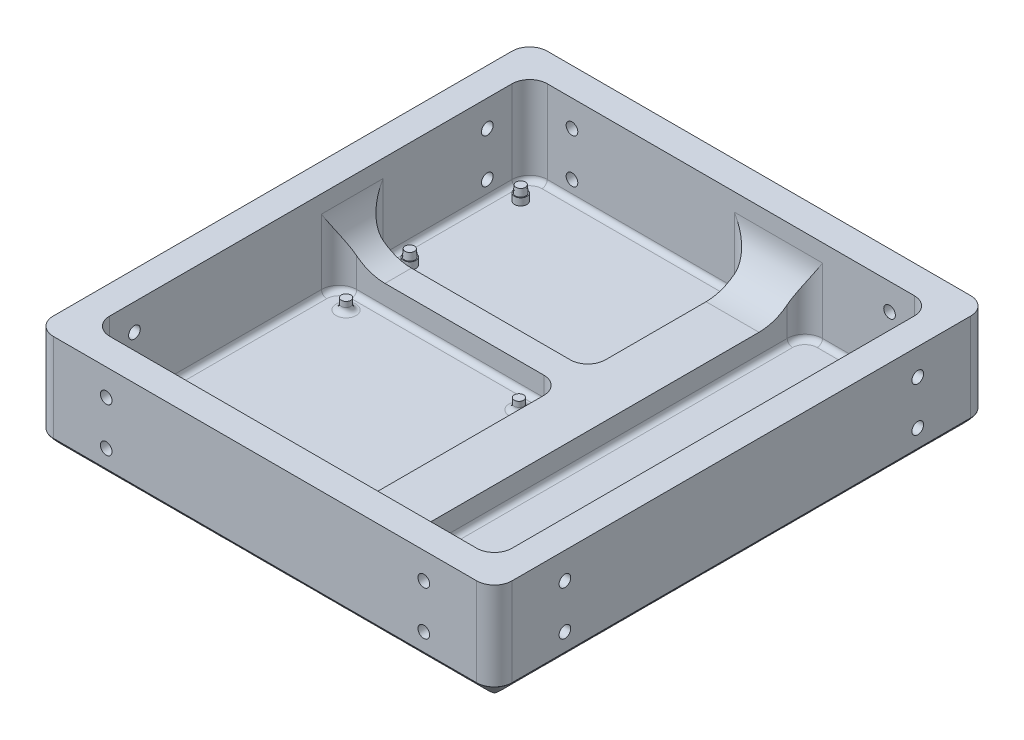
from build123d import *
from OCP.BRepFilletAPI import BRepFilletAPI_MakeChamfer

# Parameters (mm, degrees)
SKETCH1_W                      = 130
SKETCH1_H                      = 140
BOSS_EXTRUDE2_DEPTH            = 10
SKETCH3_R                      = 1.3
BOSS_EXTRUDE4_DEPTH            = 2
SKETCH4_R                      = 1.15
BOSS_EXTRUDE5_DEPTH            = 3
BOSS_EXTRUDE5_DRAFT            = -5
BOSS_EXTRUDE5_PROFILE_2_DEPTH  = 3
BOSS_EXTRUDE5_PROFILE_2_DRAFT  = -5
BOSS_EXTRUDE5_PROFILE_3_DEPTH  = 3
BOSS_EXTRUDE5_PROFILE_3_DRAFT  = -5
BOSS_EXTRUDE5_PROFILE_4_DEPTH  = 3
BOSS_EXTRUDE5_PROFILE_4_DRAFT  = -5
CHAMFER1_SIZE                  = 1.5
CHAMFER1_SIZE2                 = 1.38459352
SKETCH5_W                      = 110
SKETCH5_H                      = 120
BOSS_EXTRUDE6_DEPTH            = 20
SKETCH7_W                      = 114
SKETCH7_H                      = 124
SKETCH7_W_2                    = 110
SKETCH7_H_2                    = 120
CUT_EXTRUDE2_DEPTH             = 20
SKETCH9_W                      = 15
SKETCH9_H                      = 124
BOSS_EXTRUDE8_DEPTH            = 5
SKETCH10_W                     = 63
SKETCH10_H                     = 7.5
BOSS_EXTRUDE9_DEPTH            = 5
SKETCH12_W                     = 63
SKETCH12_H                     = 46.5
SKETCH12_W_2                   = 36
SKETCH12_H_2                   = 124
SKETCH12_H_3                   = 70
SKETCH12_R                     = 1.327872471
SKETCH12_R_2                   = 1.253859906
CUT_EXTRUDE6_DEPTH             = 5
SKETCH14_W                     = 59.963590068
SKETCH14_H                     = 68.475850711
CUT_EXTRUDE9_DEPTH             = 7
SKETCH16_W                     = 114
SKETCH16_H                     = 124
CUT_EXTRUDE10_DEPTH            = 3
FILLET12_R                     = 13
FILLET13_R                     = 5
FILLET14_R                     = 5
FILLET15_R                     = 1.5
SKETCH24_R                     = 1.65
CUT_EXTRUDE16_DEPTH            = 10
CUT_EXTRUDE17_START            = -10
SKETCH25_R                     = 1.65
CUT_EXTRUDE17_DEPTH            = 10
SKETCH26_R                     = 1.65
CUT_EXTRUDE18_DEPTH            = 10
CUT_EXTRUDE19_START            = -10
SKETCH27_R                     = 1.65
CUT_EXTRUDE19_DEPTH            = 10
FILLET17_SIZE                  = 5
SKETCH30_R                     = 1.75
BOSS_EXTRUDE10_DEPTH           = 2
SKETCH31_R                     = 1.5
BOSS_EXTRUDE11_DEPTH           = 2
BOSS_EXTRUDE11_DRAFT           = 5
BOSS_EXTRUDE11_PROFILE_2_DEPTH = 2
BOSS_EXTRUDE11_PROFILE_2_DRAFT = 5


with BuildPart() as part:
    # Sketch1 → Boss-Extrude2 (new body)
    with BuildSketch(Plane(origin=(0, 0, 0), x_dir=(1, 0, 0), z_dir=(0, 1, 0))):
        with Locations((-18.656773153, -29.741986999)):
            Rectangle(SKETCH1_W, SKETCH1_H)
    extrude(amount=BOSS_EXTRUDE2_DEPTH)

    # Sketch3 → Boss-Extrude4 (add)
    with BuildSketch(Plane(origin=(0, 10, 0), x_dir=(1, 0, 0), z_dir=(0, 1, 0))):
        with Locations(Location((-68.656773153, -26.741986999, 0), (0, 0, 270))):
            Circle(SKETCH3_R)
        with Locations(Location((-19.656773153, -26.741986999, 0), (0, 0, 270))):
            Circle(SKETCH3_R)
        with Locations(Location((-68.656773153, -84.741986999, 0), (0, 0, 270))):
            Circle(SKETCH3_R)
        with Locations(Location((-19.656773153, -84.741986999, 0), (0, 0, 270))):
            Circle(SKETCH3_R)
    extrude(amount=BOSS_EXTRUDE4_DEPTH)


with BuildPart() as boss_extrude5_tool:
    # Sketch4 → Boss-Extrude5 (with draft: the straight prism first)
    with BuildSketch(Plane(origin=(0, 12, 0), x_dir=(1, 0, 0), z_dir=(0, 1, 0))):
        with Locations((-68.656773153, -26.741986999)):
            Circle(SKETCH4_R)
    extrude(amount=BOSS_EXTRUDE5_DEPTH)
    # Boss-Extrude5: the draft: its side faces are tilted about the plane it starts from
    boss_extrude5_sides = [boss_extrude5_tool.faces().sort_by_distance(p)[0] for p in [
        (-69.806773153, 13.5, 26.741986999),
    ]]
    draft(boss_extrude5_sides, Plane(origin=(0, 12, 0), x_dir=(1, 0, 0), z_dir=(0, 1, 0)), BOSS_EXTRUDE5_DRAFT)


with BuildPart() as part_1:
    add(part.part)

    # Boss-Extrude5: add boss_extrude5_tool
    add(boss_extrude5_tool.part)


with BuildPart() as boss_extrude5_profile_2_tool:
    # Sketch4 → Boss-Extrude5 profile 2 (with draft: the straight prism first)
    with BuildSketch(Plane(origin=(0, 12, 0), x_dir=(1, 0, 0), z_dir=(0, 1, 0))):
        with Locations((-68.656773153, -84.741986999)):
            Circle(SKETCH4_R)
    extrude(amount=BOSS_EXTRUDE5_PROFILE_2_DEPTH)
    # Boss-Extrude5 profile 2: the draft: its side faces are tilted about the plane it starts from
    boss_extrude5_profile_2_sides = [boss_extrude5_profile_2_tool.faces().sort_by_distance(p)[0] for p in [
        (-69.806773153, 13.5, 84.741986999),
    ]]
    draft(boss_extrude5_profile_2_sides, Plane(origin=(0, 12, 0), x_dir=(1, 0, 0), z_dir=(0, 1, 0)), BOSS_EXTRUDE5_PROFILE_2_DRAFT)


with BuildPart() as part_2:
    add(part_1.part)

    # Boss-Extrude5 profile 2: add boss_extrude5_profile_2_tool
    add(boss_extrude5_profile_2_tool.part)


with BuildPart() as boss_extrude5_profile_3_tool:
    # Sketch4 → Boss-Extrude5 profile 3 (with draft: the straight prism first)
    with BuildSketch(Plane(origin=(0, 12, 0), x_dir=(1, 0, 0), z_dir=(0, 1, 0))):
        with Locations((-19.656773153, -84.741986999)):
            Circle(SKETCH4_R)
    extrude(amount=BOSS_EXTRUDE5_PROFILE_3_DEPTH)
    # Boss-Extrude5 profile 3: the draft: its side faces are tilted about the plane it starts from
    boss_extrude5_profile_3_sides = [boss_extrude5_profile_3_tool.faces().sort_by_distance(p)[0] for p in [
        (-20.806773153, 13.5, 84.741986999),
    ]]
    draft(boss_extrude5_profile_3_sides, Plane(origin=(0, 12, 0), x_dir=(1, 0, 0), z_dir=(0, 1, 0)), BOSS_EXTRUDE5_PROFILE_3_DRAFT)


with BuildPart() as part_3:
    add(part_2.part)

    # Boss-Extrude5 profile 3: add boss_extrude5_profile_3_tool
    add(boss_extrude5_profile_3_tool.part)


with BuildPart() as boss_extrude5_profile_4_tool:
    # Sketch4 → Boss-Extrude5 profile 4 (with draft: the straight prism first)
    with BuildSketch(Plane(origin=(0, 12, 0), x_dir=(1, 0, 0), z_dir=(0, 1, 0))):
        with Locations((-19.656773153, -26.741986999)):
            Circle(SKETCH4_R)
    extrude(amount=BOSS_EXTRUDE5_PROFILE_4_DEPTH)
    # Boss-Extrude5 profile 4: the draft: its side faces are tilted about the plane it starts from
    boss_extrude5_profile_4_sides = [boss_extrude5_profile_4_tool.faces().sort_by_distance(p)[0] for p in [
        (-20.806773153, 13.5, 26.741986999),
    ]]
    draft(boss_extrude5_profile_4_sides, Plane(origin=(0, 12, 0), x_dir=(1, 0, 0), z_dir=(0, 1, 0)), BOSS_EXTRUDE5_PROFILE_4_DRAFT)


with BuildPart() as part_4:
    add(part_3.part)

    # Boss-Extrude5 profile 4: add boss_extrude5_profile_4_tool
    add(boss_extrude5_profile_4_tool.part)

    # Chamfer1: one chamfer whose edges measure the first distance from different faces: ONE call of the kernel's chamfer builder (chamfer() names one face for all edges)
    chamfer1_edges_1 = [part_4.edges().sort_by_distance(p)[0] for p in [
        (-70.069239144, 15, 26.741986999),
    ]]
    chamfer1_side_1 = [part_4.faces().sort_by_distance(p)[0] for p in [
        (-69.938006148, 13.5, 26.741986999),
    ]]
    chamfer1_edges_2 = [part_4.edges().sort_by_distance(p)[0] for p in [
        (-70.069239144, 15, 84.741986999),
    ]]
    chamfer1_side_2 = [part_4.faces().sort_by_distance(p)[0] for p in [
        (-69.938006148, 13.5, 84.741986999),
    ]]
    chamfer1_edges_3 = [part_4.edges().sort_by_distance(p)[0] for p in [
        (-21.069239144, 15, 84.741986999),
    ]]
    chamfer1_side_3 = [part_4.faces().sort_by_distance(p)[0] for p in [
        (-20.938006148, 13.5, 84.741986999),
    ]]
    chamfer1_edges_4 = [part_4.edges().sort_by_distance(p)[0] for p in [
        (-21.069239144, 15, 26.741986999),
    ]]
    chamfer1_side_4 = [part_4.faces().sort_by_distance(p)[0] for p in [
        (-20.938006148, 13.5, 26.741986999),
    ]]
    chamfer1 = BRepFilletAPI_MakeChamfer(part_4.part.solid().wrapped)
    for e in chamfer1_edges_1:
        chamfer1.Add(CHAMFER1_SIZE, CHAMFER1_SIZE2, e.wrapped, chamfer1_side_1[0].wrapped)  # the first distance lies on this face
    for e in chamfer1_edges_2:
        chamfer1.Add(CHAMFER1_SIZE, CHAMFER1_SIZE2, e.wrapped, chamfer1_side_2[0].wrapped)  # the first distance lies on this face
    for e in chamfer1_edges_3:
        chamfer1.Add(CHAMFER1_SIZE, CHAMFER1_SIZE2, e.wrapped, chamfer1_side_3[0].wrapped)  # the first distance lies on this face
    for e in chamfer1_edges_4:
        chamfer1.Add(CHAMFER1_SIZE, CHAMFER1_SIZE2, e.wrapped, chamfer1_side_4[0].wrapped)  # the first distance lies on this face
    add(Compound.cast(chamfer1.Shape()), mode=Mode.REPLACE)

    # Sketch5 → Boss-Extrude6 (add)
    with BuildSketch(Plane(origin=(0, 10, 0), x_dir=(1, 0, 0), z_dir=(0, 1, 0))):
        Polygon((-83.656773153, -89.741986999), (-83.656773153, -99.741986999), (-73.656773153, -99.741986999), (36.343226847, -99.741986999), (46.343226847, -99.741986999), (46.343226847, -89.741986999), (46.343226847, 30.258013001), (46.343226847, 40.258013001), (36.343226847, 40.258013001), (-73.656773153, 40.258013001), (-83.656773153, 40.258013001), (-83.656773153, 30.258013001), align=None)
        with Locations((-18.656773153, -29.741986999)):
            Rectangle(SKETCH5_W, SKETCH5_H, mode=Mode.SUBTRACT)
    extrude(amount=BOSS_EXTRUDE6_DEPTH)

    # Sketch7 → Cut-Extrude2 (cut)
    with BuildSketch(Plane(origin=(0, 30, 0), x_dir=(1, 0, 0), z_dir=(0, 1, 0))):
        with Locations((-18.656773153, -29.741986999)):
            Rectangle(SKETCH7_W, SKETCH7_H)
        with Locations((-18.656773153, -29.741986999)):
            Rectangle(SKETCH7_W_2, SKETCH7_H_2, mode=Mode.SUBTRACT)
    extrude(amount=-CUT_EXTRUDE2_DEPTH, mode=Mode.SUBTRACT)

    # Sketch9 → Boss-Extrude8 (add)
    with BuildSketch(Plane(origin=(0, 10, 0), x_dir=(1, 0, 0), z_dir=(0, 1, 0))):
        with Locations((-5.156773153, -29.741986999)):
            Rectangle(SKETCH9_W, SKETCH9_H)
    extrude(amount=BOSS_EXTRUDE8_DEPTH)

    # Sketch10 → Boss-Extrude9 (add)
    with BuildSketch(Plane(origin=(0, 10, 0), x_dir=(1, 0, 0), z_dir=(0, 1, 0))):
        with Locations((-44.156773153, -17.991986999)):
            Rectangle(SKETCH10_W, SKETCH10_H)
    extrude(amount=BOSS_EXTRUDE9_DEPTH)

    # Sketch12 → Cut-Extrude6 (cut)
    # profile 1 of 3: a face of its own
    with BuildSketch(Plane(origin=(0, 10, 0), x_dir=(1, 0, 0), z_dir=(0, 1, 0))):
        with Locations((-44.156773153, 9.008013001)):
            Rectangle(SKETCH12_W, SKETCH12_H)
    # profile 2 of 3: a face of its own
    with BuildSketch(Plane(origin=(0, 10, 0), x_dir=(1, 0, 0), z_dir=(0, 1, 0))):
        with Locations((20.343226847, -29.741986999)):
            Rectangle(SKETCH12_W_2, SKETCH12_H_2)
    # profile 3 of 3: a face of its own
    with BuildSketch(Plane(origin=(0, 10, 0), x_dir=(1, 0, 0), z_dir=(0, 1, 0))):
        with Locations((-44.156773153, -56.741986999)):
            Rectangle(SKETCH12_W, SKETCH12_H_3)
        with Locations(Location((-68.684645624, -26.741986999, 0), (0, 0, 270))):
            Circle(SKETCH12_R, mode=Mode.SUBTRACT)
        with Locations(Location((-19.656773153, -26.76985947, 0), (0, 0, 270))):
            Circle(SKETCH12_R, mode=Mode.SUBTRACT)
        with Locations(Location((-19.628900682, -84.741986999, 0), (0, 0, 270))):
            Circle(SKETCH12_R_2, mode=Mode.SUBTRACT)
        with Locations(Location((-68.656773153, -84.714114528, 0), (0, 0, 270))):
            Circle(SKETCH12_R_2, mode=Mode.SUBTRACT)
    extrude(amount=-CUT_EXTRUDE6_DEPTH, mode=Mode.SUBTRACT)

    # Sketch14 → Cut-Extrude9 (cut)
    with BuildSketch(Plane(origin=(0, 15, 0), x_dir=(1, 0, 0), z_dir=(0, 1, 0))):
        with Locations((-45.674978119, -55.979912355)):
            Rectangle(SKETCH14_W, SKETCH14_H)
    extrude(amount=-CUT_EXTRUDE9_DEPTH, mode=Mode.SUBTRACT)

    # Sketch16 → Cut-Extrude10 (cut)
    with BuildSketch(Plane(origin=(0, 15, 0), x_dir=(1, 0, 0), z_dir=(0, 1, 0))):
        with Locations((-18.656773153, -29.741986999)):
            Rectangle(SKETCH16_W, SKETCH16_H)
    extrude(amount=-CUT_EXTRUDE10_DEPTH, mode=Mode.SUBTRACT)

    # Fillet12
    fillet12_edges = [part_4.edges().sort_by_distance(p)[0] for p in [
        (-75.656773153, 12, 17.991986999),
        (-5.156773153, 12, -32.258013001),
        (-5.156773153, 12, 91.741986999),
    ]]
    fillet(fillet12_edges, radius=FILLET12_R)

    # Fillet13
    fillet13_edges = [part_4.edges().sort_by_distance(p)[0] for p in [
        (-75.656773153, 15, 21.741986999),
        (-75.656773153, 15, 14.241986999),
        (-12.656773153, 8.5, 21.741986999),
        (-12.656773153, 15, 91.741986999),
        (2.343226847, 15, 91.741986999),
        (2.343226847, 15, -32.258013001),
        (-12.656773153, 8.5, 14.241986999),
        (-12.656773153, 15, -32.258013001),
        (38.343226847, 17.5, 91.741986999),
        (38.343226847, 17.5, -32.258013001),
        (-75.656773153, 17.5, -32.258013001),
        (-75.656773153, 17.5, 91.741986999),
    ]]
    fillet(fillet13_edges, radius=FILLET13_R)

    # Fillet14
    fillet14_edges = [part_4.edges().sort_by_distance(p)[0] for p in [
        (-83.656773153, 15, -40.258013001),
        (46.343226847, 15, -40.258013001),
        (46.343226847, 15, 99.741986999),
        (-83.656773153, 15, 99.741986999),
    ]]
    fillet(fillet14_edges, radius=FILLET14_R)

    # Fillet15
    fillet15_edges = [part_4.edges().sort_by_distance(p)[0] for p in [
        (-68.656773153, 5, 83.460254623),
        (-19.628900682, 5, 83.488127094),
        (-19.656773153, 5, 25.441986999),
        (-68.684645624, 5, 25.414114528),
        (2.343226847, 5, 29.741986999),
        (20.343226847, 5, 91.741986999),
        (38.343226847, 5, 29.741986999),
        (20.343226847, 5, -32.258013001),
        (3.807692941, 5, -30.793546907),
        (36.878760753, 5, 90.277520905),
        (36.878760753, 5, -30.793546907),
        (3.807692941, 5, 90.277520905),
        (-44.156773153, 5, 91.741986999),
        (-44.156773153, 5, 21.741986999),
        (-12.656773153, 5, 56.741986999),
        (-75.656773153, 5, 56.741986999),
        (-14.121239247, 5, 90.277520905),
        (-74.192307059, 5, 90.277520905),
        (-14.121239247, 5, 23.206453093),
        (-74.192307059, 5, 23.206453093),
        (-75.656773153, 5, -9.008013001),
        (-44.156773153, 5, -32.258013001),
        (-44.156773153, 5, 14.241986999),
        (-12.656773153, 5, -9.008013001),
        (-74.192307059, 5, -30.793546907),
        (-14.121239247, 5, -30.793546907),
        (-14.121239247, 5, 12.777520905),
        (-74.192307059, 5, 12.777520905),
    ]]
    fillet(fillet15_edges, radius=FILLET15_R)

    # Sketch24 → Cut-Extrude16 (cut)
    with BuildSketch(Plane(origin=(46.343226847, 0, 0), x_dir=(0, 0, -1), z_dir=(1, 0, 0))):
        with Locations((-79.741986999, 22.5)):
            Circle(SKETCH24_R)
        with Locations((-79.741986999, 10)):
            Circle(SKETCH24_R)
        with Locations((20.258013001, 22.5)):
            Circle(SKETCH24_R)
        with Locations((20.258013001, 10)):
            Circle(SKETCH24_R)
    extrude(amount=-CUT_EXTRUDE16_DEPTH, mode=Mode.SUBTRACT)

    # Sketch25 → Cut-Extrude17 (cut)
    with BuildSketch(Plane.ZY.offset(83.656773153).offset(CUT_EXTRUDE17_START)):
        with Locations(Location((-20.258013001, 22.5, 0), (0, 0, 180))):
            Circle(SKETCH25_R)
        with Locations(Location((-20.258013001, 10, 0), (0, 0, 180))):
            Circle(SKETCH25_R)
        with Locations(Location((79.741986999, 10, 0), (0, 0, 180))):
            Circle(SKETCH25_R)
        with Locations(Location((79.741986999, 22.5, 0), (0, 0, 180))):
            Circle(SKETCH25_R)
    extrude(amount=CUT_EXTRUDE17_DEPTH, mode=Mode.SUBTRACT)

    # Sketch26 → Cut-Extrude18 (cut)
    with BuildSketch(Plane.XY.offset(99.741986999)):
        with Locations((-63.656773153, 22.5)):
            Circle(SKETCH26_R)
        with Locations((-63.656773153, 10)):
            Circle(SKETCH26_R)
        with Locations((26.343226847, 10)):
            Circle(SKETCH26_R)
        with Locations((26.343226847, 22.5)):
            Circle(SKETCH26_R)
    extrude(amount=-CUT_EXTRUDE18_DEPTH, mode=Mode.SUBTRACT)

    # Sketch27 → Cut-Extrude19 (cut)
    with BuildSketch(Plane(origin=(0, 0, -40.258013001), x_dir=(-1, 0, 0), z_dir=(0, 0, -1)).offset(CUT_EXTRUDE19_START)):
        with Locations(Location((-26.343226847, 22.5, 0), (0, 0, 180))):
            Circle(SKETCH27_R)
        with Locations(Location((-26.343226847, 10, 0), (0, 0, 180))):
            Circle(SKETCH27_R)
        with Locations(Location((63.656773153, 22.5, 0), (0, 0, 180))):
            Circle(SKETCH27_R)
        with Locations(Location((63.656773153, 10, 0), (0, 0, 180))):
            Circle(SKETCH27_R)
    extrude(amount=CUT_EXTRUDE19_DEPTH, mode=Mode.SUBTRACT)

    # Fillet17
    # a fillet whose section is not a circle: 5 mm, written as the material it takes off along each edge
    with BuildSketch(Plane(origin=(41.343226847, 0, -35.258013001), x_dir=(1, 0, 0), z_dir=(0, 0, 1))) as fillet17_piece_1:
        with BuildLine():
            Bezier((5, FILLET17_SIZE), (5, 0), (5 - FILLET17_SIZE, 0), weights=[1, 0.070710678, 1])
            Line((5 - FILLET17_SIZE, 0), (5, 0))
            Line((5, 0), (5, FILLET17_SIZE))
        make_face()
    revolve(axis=Axis((41.343226847, 0, -35.258013001), (0, 1, 0)), revolution_arc=90, mode=Mode.SUBTRACT)
    with BuildSketch(Plane(origin=(-78.656773153, 0, -40.258013001), x_dir=(0, 1, 0), z_dir=(1, 0, 0)), Plane(origin=(41.343226847, 0, 99.741986999), x_dir=(0, 1, 0), z_dir=(-1, 0, 0))) as fillet17_piece_2:
        with BuildLine():
            Bezier((FILLET17_SIZE, 0), (0, 0), (0, FILLET17_SIZE), weights=[1, 0.070710678, 1])
            Line((0, FILLET17_SIZE), (0, 0))
            Line((0, 0), (FILLET17_SIZE, 0))
        make_face()
    extrude(amount=120, mode=Mode.SUBTRACT)
    with BuildSketch(Plane(origin=(-78.656773153, 0, -35.258013001), x_dir=(0, 0, -1), z_dir=(1, 0, 0))) as fillet17_piece_3:
        with BuildLine():
            Bezier((5, FILLET17_SIZE), (5, 0), (5 - FILLET17_SIZE, 0), weights=[1, 0.070710678, 1])
            Line((5 - FILLET17_SIZE, 0), (5, 0))
            Line((5, 0), (5, FILLET17_SIZE))
        make_face()
    revolve(axis=Axis((-78.656773153, 0, -35.258013001), (0, 1, 0)), revolution_arc=90, mode=Mode.SUBTRACT)
    with BuildSketch(Plane(origin=(-83.656773153, 0, 94.741986999), x_dir=(0, 1, 0), z_dir=(0, 0, -1)), Plane(origin=(46.343226847, 0, -35.258013001), x_dir=(0, 1, 0), z_dir=(0, 0, 1))) as fillet17_piece_4:
        with BuildLine():
            Bezier((FILLET17_SIZE, 0), (0, 0), (0, FILLET17_SIZE), weights=[1, 0.070710678, 1])
            Line((0, FILLET17_SIZE), (0, 0))
            Line((0, 0), (FILLET17_SIZE, 0))
        make_face()
    extrude(amount=130, mode=Mode.SUBTRACT)
    with BuildSketch(Plane(origin=(-78.656773153, 0, 94.741986999), x_dir=(0, 0, 1), z_dir=(1, 0, 0))) as fillet17_piece_5:
        with BuildLine():
            Bezier((5, -FILLET17_SIZE), (5, 0), (5 - FILLET17_SIZE, 0), weights=[1, 0.070710678, 1])
            Line((5 - FILLET17_SIZE, 0), (5, 0))
            Line((5, 0), (5, -FILLET17_SIZE))
        make_face()
    revolve(axis=Axis((-78.656773153, 0, 94.741986999), (0, -1, 0)), revolution_arc=90, mode=Mode.SUBTRACT)
    with BuildSketch(Plane(origin=(41.343226847, 0, 94.741986999), x_dir=(1, 0, 0), z_dir=(0, 0, -1))) as fillet17_piece_6:
        with BuildLine():
            Bezier((5, -FILLET17_SIZE), (5, 0), (5 - FILLET17_SIZE, 0), weights=[1, 0.070710678, 1])
            Line((5 - FILLET17_SIZE, 0), (5, 0))
            Line((5, 0), (5, -FILLET17_SIZE))
        make_face()
    revolve(axis=Axis((41.343226847, 0, 94.741986999), (0, -1, 0)), revolution_arc=90, mode=Mode.SUBTRACT)

    # Sketch30 → Boss-Extrude10 (add)
    with BuildSketch(Plane(origin=(0, 5, 0), x_dir=(1, 0, 0), z_dir=(0, 1, 0))):
        with Locations(Location((-70.656773153, 24.723013001, 0), (0, 0, 270))):
            Circle(SKETCH30_R)
        with Locations(Location((-70.656773153, -6.706986999, 0), (0, 0, 270))):
            Circle(SKETCH30_R)
    extrude(amount=BOSS_EXTRUDE10_DEPTH)


with BuildPart() as boss_extrude11_tool:
    # Sketch31 → Boss-Extrude11 (with draft: the straight prism first)
    with BuildSketch(Plane(origin=(0, 7, 0), x_dir=(1, 0, 0), z_dir=(0, 1, 0))):
        with Locations((-70.656773153, 24.723013001)):
            Circle(SKETCH31_R)
    extrude(amount=BOSS_EXTRUDE11_DEPTH)
    # Boss-Extrude11: the draft: its side faces are tilted about the plane it starts from
    boss_extrude11_sides = [boss_extrude11_tool.faces().sort_by_distance(p)[0] for p in [
        (-72.156773153, 8, -24.723013001),
    ]]
    draft(boss_extrude11_sides, Plane(origin=(0, 7, 0), x_dir=(1, 0, 0), z_dir=(0, 1, 0)), BOSS_EXTRUDE11_DRAFT)


with BuildPart() as part_5:
    add(part_4.part)

    # Boss-Extrude11: add boss_extrude11_tool
    add(boss_extrude11_tool.part)


with BuildPart() as boss_extrude11_profile_2_tool:
    # Sketch31 → Boss-Extrude11 profile 2 (with draft: the straight prism first)
    with BuildSketch(Plane(origin=(0, 7, 0), x_dir=(1, 0, 0), z_dir=(0, 1, 0))):
        with Locations((-70.656773153, -6.706986999)):
            Circle(SKETCH31_R)
    extrude(amount=BOSS_EXTRUDE11_PROFILE_2_DEPTH)
    # Boss-Extrude11 profile 2: the draft: its side faces are tilted about the plane it starts from
    boss_extrude11_profile_2_sides = [boss_extrude11_profile_2_tool.faces().sort_by_distance(p)[0] for p in [
        (-72.156773153, 8, 6.706986999),
    ]]
    draft(boss_extrude11_profile_2_sides, Plane(origin=(0, 7, 0), x_dir=(1, 0, 0), z_dir=(0, 1, 0)), BOSS_EXTRUDE11_PROFILE_2_DRAFT)


with BuildPart() as part_6:
    add(part_5.part)

    # Boss-Extrude11 profile 2: add boss_extrude11_profile_2_tool
    add(boss_extrude11_profile_2_tool.part)


solid = part_6.part
